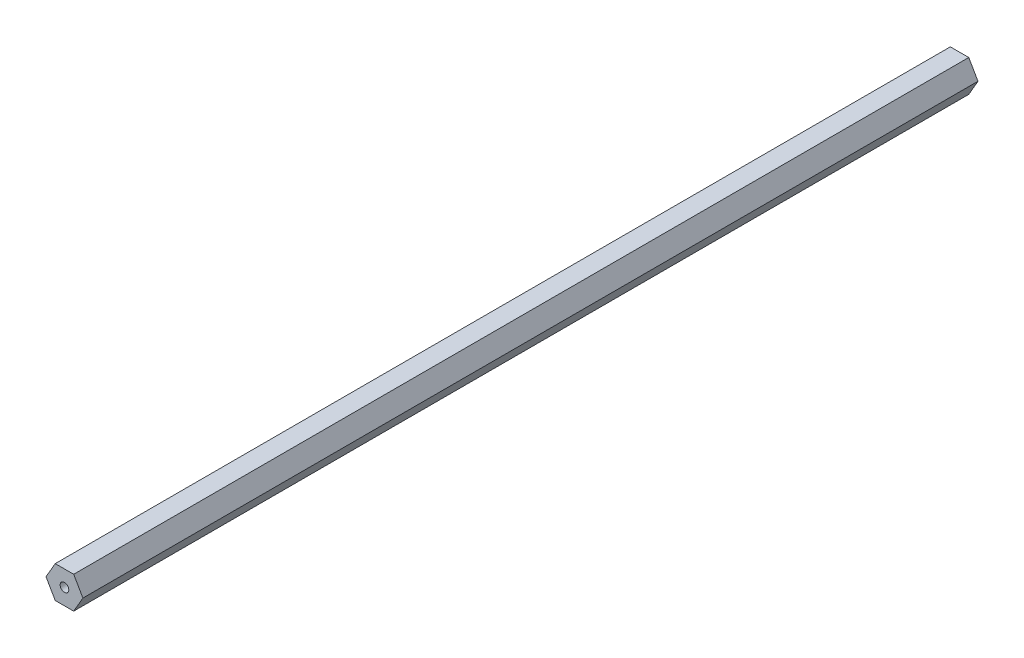
from build123d import *

# Parameters (mm, degrees)
SKETCH1_R           = 1.7145
BOSS_EXTRUDE1_DEPTH = 177.8


with BuildPart() as part:
    # Sketch1 → Boss-Extrude1 (new, symmetric)
    with BuildSketch(Plane.XY):
        Polygon((7.332348419, 0), (3.666174209, 6.35), (-3.666174209, 6.35), (-7.332348419, 0), (-3.666174209, -6.35), (3.666174209, -6.35), align=None)
        Circle(SKETCH1_R, mode=Mode.SUBTRACT)
    extrude(amount=BOSS_EXTRUDE1_DEPTH, both=True)


solid = part.part
